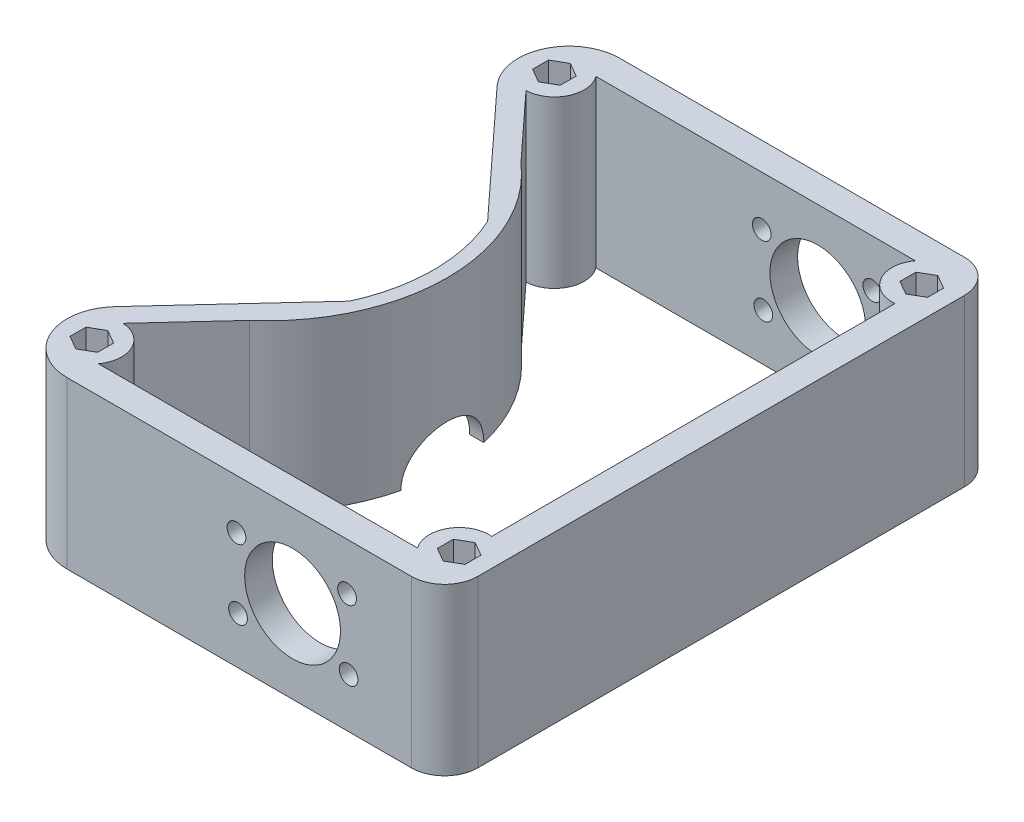
from build123d import *

# Parameters (mm, degrees)
SKETCH1_W               = 95.25
SKETCH1_H               = 6.35
BOSS_EXTRUDE1_DEPTH     = 38.1
SKETCH2_W               = 6.35
SKETCH2_H               = 127
BOSS_EXTRUDE2_DEPTH     = 38.1
SKETCH3_W               = 88.9
SKETCH3_H               = 6.35
BOSS_EXTRUDE3_DEPTH     = 38.1
SKETCH4_R               = 11
CUT_EXTRUDE1_DEPTH      = 149.412147835
SKETCH5_R               = 2.15265
CUT_EXTRUDE2_DEPTH      = 149.412147835
FILLET1_R               = 7.62
BOSS_EXTRUDE4_DEPTH     = 38.1
CUT_EXTRUDE8_REACH      = 171.022
CUT_EXTRUDE8_END_RADIUS = 38.1
FILLET2_R               = 11.688947
FILLET3_R               = 11.688947
FILLET4_R               = 6.35
SKETCH15_R              = 6.841174209
BOSS_EXTRUDE7_DEPTH     = 38.1
CUT_EXTRUDE12_DEPTH     = 157.640484095


with BuildPart() as part:
    # Sketch1 → Boss-Extrude1 (new body)
    with BuildSketch(Plane(origin=(0, 0, 0), x_dir=(1, 0, 0), z_dir=(0, 1, 0))):
        with Locations((19.05, 12.7)):
            Rectangle(SKETCH1_W, SKETCH1_H)
    extrude(amount=BOSS_EXTRUDE1_DEPTH)

    # Sketch2 → Boss-Extrude2 (add)
    with BuildSketch(Plane(origin=(0, 38.1, 0), x_dir=(1, 0, 0), z_dir=(0, 1, 0))):
        with Locations((63.5, 73.025)):
            Rectangle(SKETCH2_W, SKETCH2_H)
    extrude(amount=-BOSS_EXTRUDE2_DEPTH)

    # Sketch3 → Boss-Extrude3 (add)
    with BuildSketch(Plane(origin=(0, 38.1, 0), x_dir=(1, 0, 0), z_dir=(0, 1, 0))):
        with Locations((15.875, 133.35)):
            Rectangle(SKETCH3_W, SKETCH3_H)
    extrude(amount=-BOSS_EXTRUDE3_DEPTH)

    # Sketch4 → Cut-Extrude1 (cut, through all)
    with BuildSketch(Plane(origin=(0, 0, -136.525), x_dir=(-1, 0, 0), z_dir=(0, 0, -1))):
        with Locations((-31.75, 19.05)):
            Circle(SKETCH4_R)
    extrude(amount=-CUT_EXTRUDE1_DEPTH, mode=Mode.SUBTRACT)

    # Sketch5 → Cut-Extrude2 (cut, through all)
    with BuildSketch(Plane(origin=(0, 0, -136.525), x_dir=(-1, 0, 0), z_dir=(0, 0, -1))):
        with Locations((-18.877667779, 26.704865736)):
            Circle(SKETCH5_R)
        with Locations((-19.228536904, 10.833743663)):
            Circle(SKETCH5_R)
        with Locations((-44.622332221, 11.395134264)):
            Circle(SKETCH5_R)
        with Locations((-44.271463096, 27.266256337)):
            Circle(SKETCH5_R)
    extrude(amount=-CUT_EXTRUDE2_DEPTH, mode=Mode.SUBTRACT)

    # Fillet1
    fillet1_edges = [part.edges().sort_by_distance(p)[0] for p in [
        (66.675, 19.05, -136.525),
        (66.675, 19.05, -9.525),
    ]]
    fillet(fillet1_edges, radius=FILLET1_R)

    # Sketch10 → Boss-Extrude4 (add)
    with BuildSketch(Plane(origin=(0, 38.1, 0), x_dir=(1, 0, 0), z_dir=(0, 1, 0))):
        with BuildLine():
            Line((-28.575, 15.875), (-28.575, 9.525))
            Line((-28.575, 9.525), (-31.75, 9.525))
            Line((-31.75, 9.525), (-31.75, 25.781))
            Line((-31.75, 25.781), (-2.821027965, 57.15))
            ThreePointArc((-2.821027965, 57.15), (0.643811071, 73.025), (-2.821027965, 88.9))
            Line((-2.821027965, 88.9), (-31.75, 120.269))
            Line((-31.75, 120.269), (-31.75, 136.525))
            Line((-31.75, 136.525), (-28.575, 136.525))
            Line((-28.575, 136.525), (-28.575, 123.825))
            Line((-28.575, 123.825), (-10.494392478, 104.219375))
            ThreePointArc((-10.494392478, 104.219375), (3.775200806, 73.025), (-10.494392478, 41.830625))
            Line((-10.494392478, 41.830625), (-28.575, 22.225))
            Line((-28.575, 22.225), (-28.575, 15.875))
        make_face()
    extrude(amount=-BOSS_EXTRUDE4_DEPTH)

    # Cut-Extrude8: up to this cylinder (the profile starts outside it)
    cut_extrude8_end = Plane(origin=(-37.456188929, 4.042536, -73.025), z_dir=(0, 1, 0)) * Cylinder(CUT_EXTRUDE8_END_RADIUS, 419.244, mode=Mode.PRIVATE)
    # Sketch12 → Cut-Extrude8 (cut, up to the surface)
    with BuildSketch(Plane.ZY.offset(-60.325), mode=Mode.PRIVATE) as cut_extrude8_sk1:
        with BuildLine():
            Line((-82.55, 0), (-63.5, 0))
            ThreePointArc((-63.5, 0), (-73.025, 9.525), (-82.55, 0))
        make_face()
    cut_extrude8_tool1 = extrude(cut_extrude8_sk1.sketch, amount=CUT_EXTRUDE8_REACH, mode=Mode.PRIVATE) - cut_extrude8_end
    add(cut_extrude8_tool1.solids().sort_by_distance((60.325, 4.042536, -73.025))[0], mode=Mode.SUBTRACT)

    # Fillet2
    fillet2_edges = [part.edges().sort_by_distance(p)[0] for p in [
        (-31.75, 19.05, -136.525),
        (-31.75, 19.05, -120.269),
    ]]
    fillet(fillet2_edges, radius=FILLET2_R - 0.0001)  # a hair under: the kernel refuses the full size

    # Fillet3
    fillet3_edges = [part.edges().sort_by_distance(p)[0] for p in [
        (-31.75, 19.05, -25.781),
        (-31.75, 19.05, -9.525),
    ]]
    fillet(fillet3_edges, radius=FILLET3_R - 0.0001)  # a hair under: the kernel refuses the full size

    # Fillet4
    fillet4_edges = [part.edges().sort_by_distance(p)[0] for p in [
        (60.325, 19.05, -15.875),
        (60.325, 19.05, -130.175),
    ]]
    fillet(fillet4_edges, radius=FILLET4_R)

    # Sketch15 → Boss-Extrude7 (add)
    # profile 1 of 4: a face of its own
    with BuildSketch(Plane(origin=(0, 38.1, 0), x_dir=(1, 0, 0), z_dir=(0, 1, 0))):
        with Locations((59.652254611, 126.150383493)):
            Circle(SKETCH15_R)
        Polygon((59.652254611, 129.816557703), (56.477254611, 127.983470598), (56.477254611, 124.317296388), (59.652254611, 122.484209284), (62.827254611, 124.317296388), (62.827254611, 127.983470598), align=None, mode=Mode.SUBTRACT)
    # profile 2 of 4: a face of its own
    with BuildSketch(Plane(origin=(0, 38.1, 0), x_dir=(1, 0, 0), z_dir=(0, 1, 0))):
        with Locations((-24.727254611, 19.899616507)):
            Circle(SKETCH15_R)
        Polygon((-21.552254611, 21.732703612), (-24.727254611, 23.565790716), (-27.902254611, 21.732703612), (-27.902254611, 18.066529402), (-24.727254611, 16.233442297), (-21.552254611, 18.066529402), align=None, mode=Mode.SUBTRACT)
    # profile 3 of 4: a face of its own
    with BuildSketch(Plane(origin=(0, 38.1, 0), x_dir=(1, 0, 0), z_dir=(0, 1, 0))):
        with Locations((-24.727254611, 126.150383493)):
            Circle(SKETCH15_R)
        Polygon((-21.552254611, 127.983470598), (-21.552254611, 124.317296388), (-24.727254611, 122.484209284), (-27.902254611, 124.317296388), (-27.902254611, 127.983470598), (-24.727254611, 129.816557703), align=None, mode=Mode.SUBTRACT)
    # profile 4 of 4: a face of its own
    with BuildSketch(Plane(origin=(0, 38.1, 0), x_dir=(1, 0, 0), z_dir=(0, 1, 0))):
        with Locations((59.652254611, 19.899616507)):
            Circle(SKETCH15_R)
        Polygon((56.477254611, 18.066529402), (56.477254611, 21.732703612), (59.652254611, 23.565790716), (62.827254611, 21.732703612), (62.827254611, 18.066529402), (59.652254611, 16.233442297), align=None, mode=Mode.SUBTRACT)
    extrude(amount=-BOSS_EXTRUDE7_DEPTH)

    # Sketch21 → Cut-Extrude12 (cut, through all)
    with BuildSketch(Plane(origin=(0, 38.1, 0), x_dir=(1, 0, 0), z_dir=(0, 1, 0))):
        Polygon((-21.552254611, 21.732703612), (-24.727254611, 23.565790716), (-27.902254611, 21.732703612), (-27.902254611, 18.066529402), (-24.727254611, 16.233442297), (-21.552254611, 18.066529402), align=None)
        Polygon((56.477254611, 18.066529402), (56.477254611, 21.732703612), (59.652254611, 23.565790716), (62.827254611, 21.732703612), (62.827254611, 18.066529402), (59.652254611, 16.233442297), align=None)
        Polygon((59.652254611, 129.816557703), (56.477254611, 127.983470598), (56.477254611, 124.317296388), (59.652254611, 122.484209284), (62.827254611, 124.317296388), (62.827254611, 127.983470598), align=None)
        Polygon((-21.552254611, 127.983470598), (-21.552254611, 124.317296388), (-24.727254611, 122.484209284), (-27.902254611, 124.317296388), (-27.902254611, 127.983470598), (-24.727254611, 129.816557703), align=None)
    extrude(amount=-CUT_EXTRUDE12_DEPTH, mode=Mode.SUBTRACT)


solid = part.part
